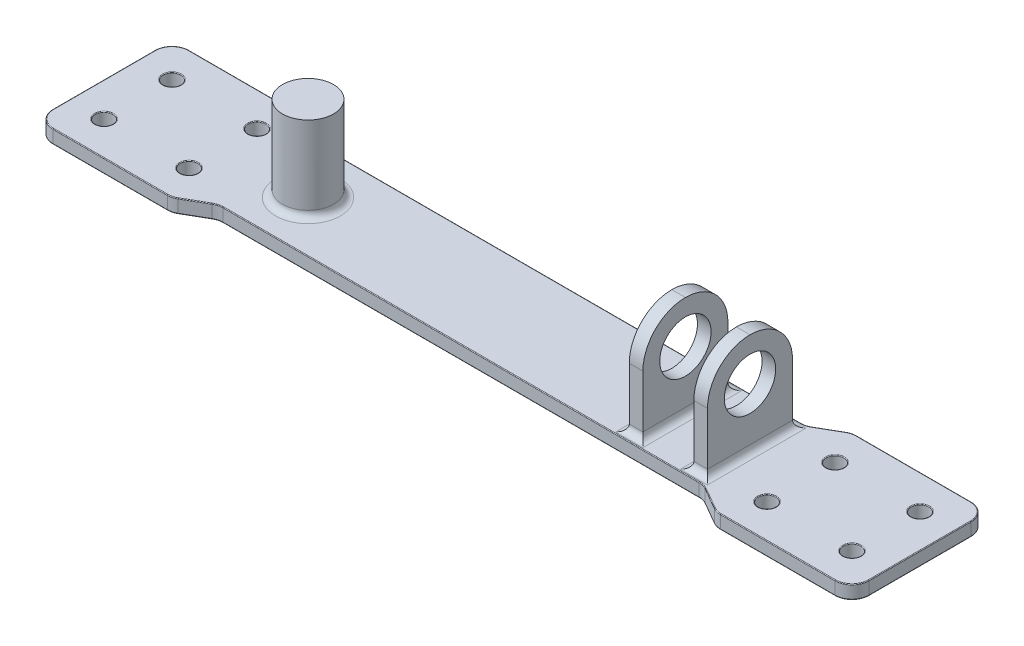
from build123d import *

# Parameters (mm, degrees)
SKETCH1_R           = 2.6
BOSS_EXTRUDE1_DEPTH = 4
SKETCH2_W           = 4
SKETCH2_H           = 25
BOSS_EXTRUDE2_DEPTH = 30
FILLET2_R           = 12.5
SKETCH4_R           = 7.55
CUT_EXTRUDE1_DEPTH  = 30
SKETCH5_R           = 7.5
BOSS_EXTRUDE3_DEPTH = 25
FILLET3_R           = 2
FILLET6_R           = 0.2


with BuildPart() as part:
    # Sketch1 → Boss-Extrude1 (new body)
    with BuildSketch(Plane(origin=(0, 0, 0), x_dir=(1, 0, 0), z_dir=(0, 1, 0))):
        with BuildLine():
            Line((-120, -15), (-120, 15))
            ThreePointArc((-120, 15), (-118.535533906, 18.535533906), (-115, 20))
            Line((-115, 20), (-81.339745962, 20))
            ThreePointArc((-81.339745962, 20), (-80.045650737, 19.829629131), (-78.839745962, 19.330127019))
            Line((-78.839745962, 19.330127019), (-72.5, 15.669872981))
            ThreePointArc((-72.5, 15.669872981), (-71.294095226, 15.170370869), (-70, 15))
            Line((-70, 15), (70, 15))
            ThreePointArc((70, 15), (71.294095226, 15.170370869), (72.5, 15.669872981))
            Line((72.5, 15.669872981), (78.839745962, 19.330127019))
            ThreePointArc((78.839745962, 19.330127019), (80.045650737, 19.829629131), (81.339745962, 20))
            Line((81.339745962, 20), (115, 20))
            ThreePointArc((115, 20), (118.535533906, 18.535533906), (120, 15))
            Line((120, 15), (120, -15))
            ThreePointArc((120, -15), (118.535533906, -18.535533906), (115, -20))
            Line((115, -20), (81.339745962, -20))
            ThreePointArc((81.339745962, -20), (80.045650737, -19.829629131), (78.839745962, -19.330127019))
            Line((78.839745962, -19.330127019), (72.5, -15.669872981))
            ThreePointArc((72.5, -15.669872981), (71.294095226, -15.170370869), (70, -15))
            Line((70, -15), (-70, -15))
            ThreePointArc((-70, -15), (-71.294095226, -15.170370869), (-72.5, -15.669872981))
            Line((-72.5, -15.669872981), (-78.839745962, -19.330127019))
            ThreePointArc((-78.839745962, -19.330127019), (-80.045650737, -19.829629131), (-81.339745962, -20))
            Line((-81.339745962, -20), (-115, -20))
            ThreePointArc((-115, -20), (-118.535533906, -18.535533906), (-120, -15))
        make_face()
        with Locations(Location((-110, 10, 0), (0, 0, 270))):
            Circle(SKETCH1_R, mode=Mode.SUBTRACT)
        with Locations(Location((-85, 10, 0), (0, 0, 270))):
            Circle(SKETCH1_R, mode=Mode.SUBTRACT)
        with Locations(Location((-85, -10, 0), (0, 0, 270))):
            Circle(SKETCH1_R, mode=Mode.SUBTRACT)
        with Locations(Location((-110, -10, 0), (0, 0, 270))):
            Circle(SKETCH1_R, mode=Mode.SUBTRACT)
        with Locations(Location((85, -10, 0), (0, 0, 90))):
            Circle(SKETCH1_R, mode=Mode.SUBTRACT)
        with Locations(Location((110, -10, 0), (0, 0, 90))):
            Circle(SKETCH1_R, mode=Mode.SUBTRACT)
        with Locations(Location((85, 10, 0), (0, 0, 90))):
            Circle(SKETCH1_R, mode=Mode.SUBTRACT)
        with Locations(Location((110, 10, 0), (0, 0, 90))):
            Circle(SKETCH1_R, mode=Mode.SUBTRACT)
    extrude(amount=BOSS_EXTRUDE1_DEPTH)

    # Sketch2 → Boss-Extrude2 (add)
    with BuildSketch(Plane(origin=(0, 4, 0), x_dir=(1, 0, 0), z_dir=(0, 1, 0))):
        with Locations((49, 0)):
            Rectangle(SKETCH2_W, SKETCH2_H)
        with Locations((68, 0)):
            Rectangle(SKETCH2_W, SKETCH2_H)
    extrude(amount=BOSS_EXTRUDE2_DEPTH)

    # Fillet2
    fillet2_edges = [part.edges().sort_by_distance(p)[0] for p in [
        (49, 34, 12.5),
        (68, 34, 12.5),
        (68, 34, -12.5),
        (49, 34, -12.5),
    ]]
    fillet(fillet2_edges, radius=FILLET2_R - 0.0001)  # a hair under: the kernel refuses the full size

    # Sketch4 → Cut-Extrude1 (cut)
    with BuildSketch(Plane.ZY.offset(-47)):
        with Locations((0, 21.5)):
            Circle(SKETCH4_R)
    extrude(amount=-CUT_EXTRUDE1_DEPTH, mode=Mode.SUBTRACT)

    # Sketch5 → Boss-Extrude3 (add)
    with BuildSketch(Plane(origin=(0, 4, 0), x_dir=(1, 0, 0), z_dir=(0, 1, 0))):
        with Locations(Location((-60, 0, 0), (0, 0, 90))):
            Circle(SKETCH5_R)
    extrude(amount=BOSS_EXTRUDE3_DEPTH)

    # Fillet3
    fillet3_edges = [part.edges().sort_by_distance(p)[0] for p in [
        (51, 4, 0),
        (49, 4, -12.5),
        (47, 4, 0),
        (49, 4, 12.5),
        (70, 4, 0),
        (68, 4, -12.5),
        (66, 4, 0),
        (68, 4, 12.5),
        (-60, 4, 7.5),
    ]]
    fillet(fillet3_edges, radius=FILLET3_R)

    # Fillet6
    fillet6_edges = [part.edges().sort_by_distance(p)[0] for p in [
        (80.045650737, 4, -19.829629131),
        (75.669872981, 4, -17.5),
        (71.294095226, 4, -15.170370869),
        (120, 0, 0),
        (118.535533906, 0, 18.535533906),
        (98.169872981, 0, 20),
        (80.045650737, 0, 19.829629131),
        (75.669872981, 0, 17.5),
        (0, 4, -15),
        (71.294095226, 0, 15.170370869),
        (0, 0, 15),
        (-71.294095226, 0, 15.170370869),
        (-75.669872981, 0, 17.5),
        (-80.045650737, 0, 19.829629131),
        (-98.169872981, 0, 20),
        (-118.535533906, 0, 18.535533906),
        (-120, 0, 0),
        (-118.535533906, 0, -18.535533906),
        (-98.169872981, 0, -20),
        (-71.294095226, 4, -15.170370869),
        (-80.045650737, 0, -19.829629131),
        (-75.669872981, 0, -17.5),
        (-71.294095226, 0, -15.170370869),
        (0, 0, -15),
        (71.294095226, 0, -15.170370869),
        (75.669872981, 0, -17.5),
        (80.045650737, 0, -19.829629131),
        (98.169872981, 0, -20),
        (118.535533906, 0, -18.535533906),
        (-75.669872981, 4, -17.5),
        (-80.045650737, 4, -19.829629131),
        (-98.169872981, 4, -20),
        (-118.535533906, 4, -18.535533906),
        (-120, 4, 0),
        (118.535533906, 4, -18.535533906),
        (-118.535533906, 4, 18.535533906),
        (-98.169872981, 4, 20),
        (-110, 0, -12.6),
        (-110, 4, -12.6),
        (-80.045650737, 4, 19.829629131),
        (-85, 0, -12.6),
        (-85, 4, -12.6),
        (-75.669872981, 4, 17.5),
        (-85, 0, 7.4),
        (-85, 4, 7.4),
        (-71.294095226, 4, 15.170370869),
        (-110, 0, 7.4),
        (-110, 4, 7.4),
        (0, 4, 15),
        (85, 0, 12.6),
        (85, 4, 12.6),
        (71.294095226, 4, 15.170370869),
        (110, 0, 12.6),
        (110, 4, 12.6),
        (75.669872981, 4, 17.5),
        (85, 0, -7.4),
        (85, 4, -7.4),
        (80.045650737, 4, 19.829629131),
        (110, 0, -7.4),
        (110, 4, -7.4),
        (98.169872981, 4, 20),
        (98.169872981, 4, -20),
        (118.535533906, 4, 18.535533906),
        (120, 4, 0),
    ]]
    fillet(fillet6_edges, radius=FILLET6_R)


solid = part.part
